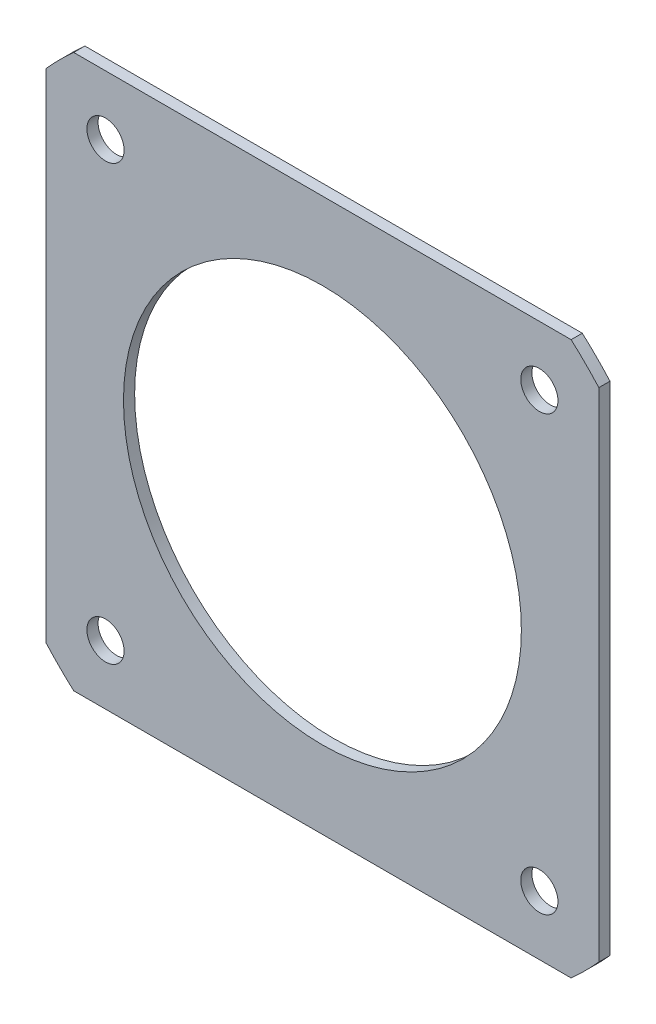
from build123d import *

# Parameters (mm, degrees)
SKETCH_1_R             = 53.5
SKETCH_1_R_2           = 5
SM_BASE_FLANGE_1_DEPTH = 3


# Sheet-metal steps are written as plain solids
with BuildPart() as part:
    # Sketch 1 → Базовая кромка1 (new body)
    with BuildSketch(Plane.XY):
        with BuildLine():
            Line((66.888811454, 60.663690552), (-66.888811454, 60.663690552))
            ThreePointArc((-66.888811454, 60.663690552), (-70.710678119, 64.289321881), (-74.336309448, 68.111188546))
            Line((-74.336309448, 68.111188546), (-74.336309448, 201.888811454))
            ThreePointArc((-74.336309448, 201.888811454), (-70.710678119, 205.710678119), (-66.888811454, 209.336309448))
            Line((-66.888811454, 209.336309448), (66.888811454, 209.336309448))
            ThreePointArc((66.888811454, 209.336309448), (70.710678119, 205.710678119), (74.336309448, 201.888811454))
            Line((74.336309448, 201.888811454), (74.336309448, 68.111188546))
            ThreePointArc((74.336309448, 68.111188546), (70.710678119, 64.289321881), (66.888811454, 60.663690552))
        make_face()
        with Locations((0, 135)):
            Circle(SKETCH_1_R, mode=Mode.SUBTRACT)
        with Locations((-58.336309448, 76.663690552)):
            Circle(SKETCH_1_R_2, mode=Mode.SUBTRACT)
        with Locations((58.336309448, 76.663690552)):
            Circle(SKETCH_1_R_2, mode=Mode.SUBTRACT)
        with Locations((58.336309448, 193.336309448)):
            Circle(SKETCH_1_R_2, mode=Mode.SUBTRACT)
        with Locations((-58.336309448, 193.336309448)):
            Circle(SKETCH_1_R_2, mode=Mode.SUBTRACT)
    extrude(amount=SM_BASE_FLANGE_1_DEPTH)


solid = part.part
